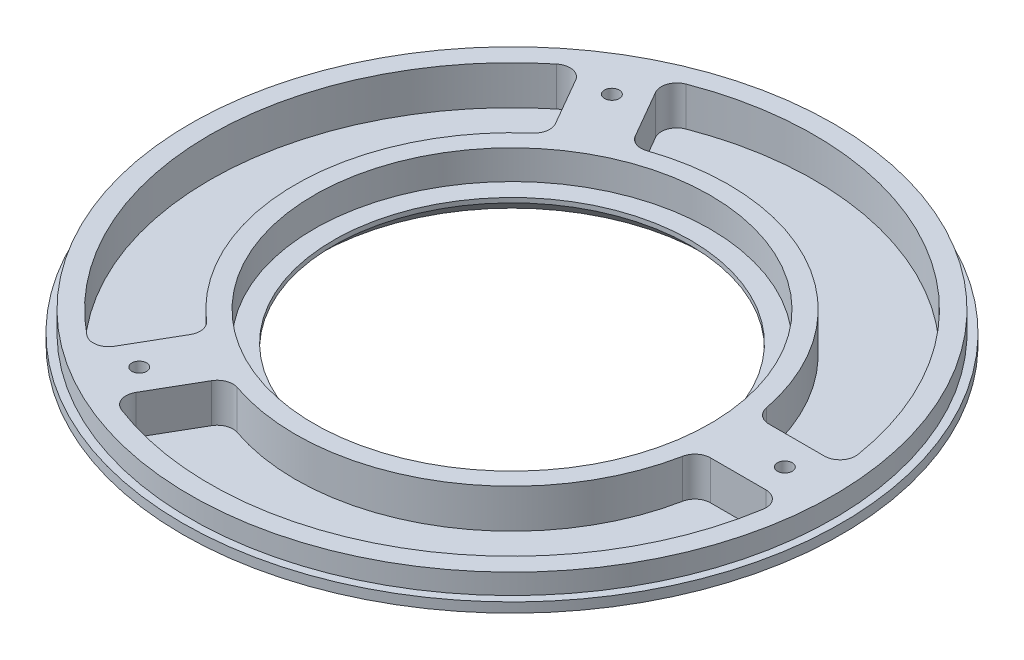
from build123d import *

# Parameters (mm, degrees)
F_90_0_0087_DIAMETER_HOLE1_D                        = 0.22098
CIRPATTERN3_COUNT                                   = 3
CUT_EXTRUDE1_DEPTH                                  = 10
FILLET1_R                                           = 4
CIRPATTERN4_COUNT                                   = 3
FILLET1_OF_CIRPATTERN4_R                            = 4
CHAMFER1_SIZE                                       = 4
BOSS_EXTRUDE1_START                                 = -7.5
SKETCH10_R                                          = 84.55
SKETCH10_R_2                                        = 82.55
BOSS_EXTRUDE1_DEPTH                                 = 7.5
CHAMFER3_SIZE                                       = 5
CHAMFER3_SIZE2                                      = 8.660254038
FILLET4_R                                           = 5
CBORE_FOR_6_BINDING_HEAD_MACHINE_SCREW1_D           = 3.7973
CBORE_FOR_6_BINDING_HEAD_MACHINE_SCREW1_CBORE_D     = 7.9375
CBORE_FOR_6_BINDING_HEAD_MACHINE_SCREW1_CBORE_DEPTH = 2.2098
CIRPATTERN5_COUNT                                   = 3


with BuildPart() as part:
    # Sketch2 → Revolve1 (revolve)
    with BuildSketch(Plane(origin=(0, 0, 0), x_dir=(0, 0, -1), z_dir=(1, 0, 0))):
        Polygon((-45.8, 0), (-82.55, 0), (-82.55, 12.7), (-50.8, 12.7), (-50.8, 5.2), (-45.8, 5.2), align=None)
    revolve(axis=Axis((0, -0.5, 0), (0, 1, 0)))

    # #90 (0.0087) Diameter Hole1 (through all)
    with Locations(Plane(origin=(0, 12.7, 0), x_dir=(1, 0, 0), z_dir=(0, 1, 0))):
        with Locations((-35, 60.621778265)):
            f_90_0_0087_diameter_hole1 = Hole(F_90_0_0087_DIAMETER_HOLE1_D / 2)

    # CirPattern3: #90 (0.0087) Diameter Hole1 ×3 about axis
    cirpattern3_axis = Axis((0, -0.5, 0), (0, 1, 0))
    for i in range(1, CIRPATTERN3_COUNT):
        add(f_90_0_0087_diameter_hole1.rotate(cirpattern3_axis, i * 360 / CIRPATTERN3_COUNT), mode=Mode.SUBTRACT)

    # Sketch8 → Cut-Extrude1 (cut)
    with BuildSketch(Plane(origin=(0, 12.7, 0), x_dir=(1, 0, 0), z_dir=(0, 1, 0))):
        with BuildLine():
            Line((-21.025494874, 51.417225376), (-32.098048841, 70.595451416))
            ThreePointArc((-32.098048841, 70.595451416), (38.775, 67.160270063), (77.186478738, 7.5))
            Line((77.186478738, 7.5), (55.041370804, 7.5))
            ThreePointArc((55.041370804, 7.5), (27.775, 48.10771118), (-21.025494874, 51.417225376))
        make_face()
    cut_extrude1 = extrude(amount=-CUT_EXTRUDE1_DEPTH, mode=Mode.SUBTRACT)

    # Fillet1
    fillet1_edges = [part.edges().sort_by_distance(p)[0] for p in [
        (-21.025494874, 7.7, -51.417225376),
        (55.041370804, 7.7, -7.5),
        (77.186478738, 7.7, -7.5),
        (-32.098048841, 7.7, -70.595451416),
    ]]
    fillet(fillet1_edges, radius=FILLET1_R)

    # CirPattern4: Cut-Extrude1 ×3 about axis
    cirpattern4_axis = Axis((0, -0.5, 0), (0, 1, 0))
    for i in range(1, CIRPATTERN4_COUNT):
        add(cut_extrude1.rotate(cirpattern4_axis, i * 360 / CIRPATTERN4_COUNT), mode=Mode.SUBTRACT)

    # Fillet1 of CirPattern4
    fillet1_of_cirpattern4_edges = [part.edges().sort_by_distance(p)[0] for p in [
        (-34.01587593, 7.7, 43.917225376),
        (-34.01587593, 7.7, -43.917225376),
        (-45.088429897, 7.7, -63.095451416),
        (-45.088429897, 7.7, 63.095451416),
        (55.041370804, 7.7, 7.5),
        (-21.025494874, 7.7, 51.417225376),
        (-32.098048841, 7.7, 70.595451416),
        (77.186478738, 7.7, 7.5),
    ]]
    fillet(fillet1_of_cirpattern4_edges, radius=FILLET1_OF_CIRPATTERN4_R)

    # Chamfer1
    chamfer1_edges = [part.edges().sort_by_distance(p)[0] for p in [
        (0, 0, -45.8),
    ]]
    chamfer(chamfer1_edges, length=CHAMFER1_SIZE)

    # Sketch10 → Boss-Extrude1 (add)
    with BuildSketch(Plane.XZ.offset(BOSS_EXTRUDE1_START)):
        Circle(SKETCH10_R)
        Circle(SKETCH10_R_2, mode=Mode.SUBTRACT)
    extrude(amount=BOSS_EXTRUDE1_DEPTH)

    # Chamfer3
    chamfer3_edges = [part.edges().sort_by_distance(p)[0] for p in [
        (-84.55, 0, 0),
    ]]
    chamfer3_side = [part.faces().sort_by_distance(p)[0] for p in [
        (-84.55, 3.75, 0),
    ]]
    chamfer(chamfer3_edges, length=CHAMFER3_SIZE, length2=CHAMFER3_SIZE2, reference=chamfer3_side[0])

    # Fillet4
    fillet4_edges = [part.edges().sort_by_distance(p)[0] for p in [
        (-75.889745962, 0, 0),
    ]]
    fillet(fillet4_edges, radius=FILLET4_R)

    # CBORE for #6 Binding Head Machine Screw1 (through all)
    with Locations(Plane(origin=(0, 0, 0), x_dir=(-1, 0, 0), z_dir=(0, -1, 0))):
        with Locations((35, 60.621778265)):
            cbore_for_6_binding_head_machine_screw1 = CounterBoreHole(CBORE_FOR_6_BINDING_HEAD_MACHINE_SCREW1_D / 2, CBORE_FOR_6_BINDING_HEAD_MACHINE_SCREW1_CBORE_D / 2, CBORE_FOR_6_BINDING_HEAD_MACHINE_SCREW1_CBORE_DEPTH)

    # CirPattern5: CBORE for #6 Binding Head Machine Screw1 ×3 about axis
    cirpattern5_axis = Axis((0, -0.5, 0), (0, 1, 0))
    for i in range(1, CIRPATTERN5_COUNT):
        add(cbore_for_6_binding_head_machine_screw1.rotate(cirpattern5_axis, i * 360 / CIRPATTERN5_COUNT), mode=Mode.SUBTRACT)


solid = part.part
